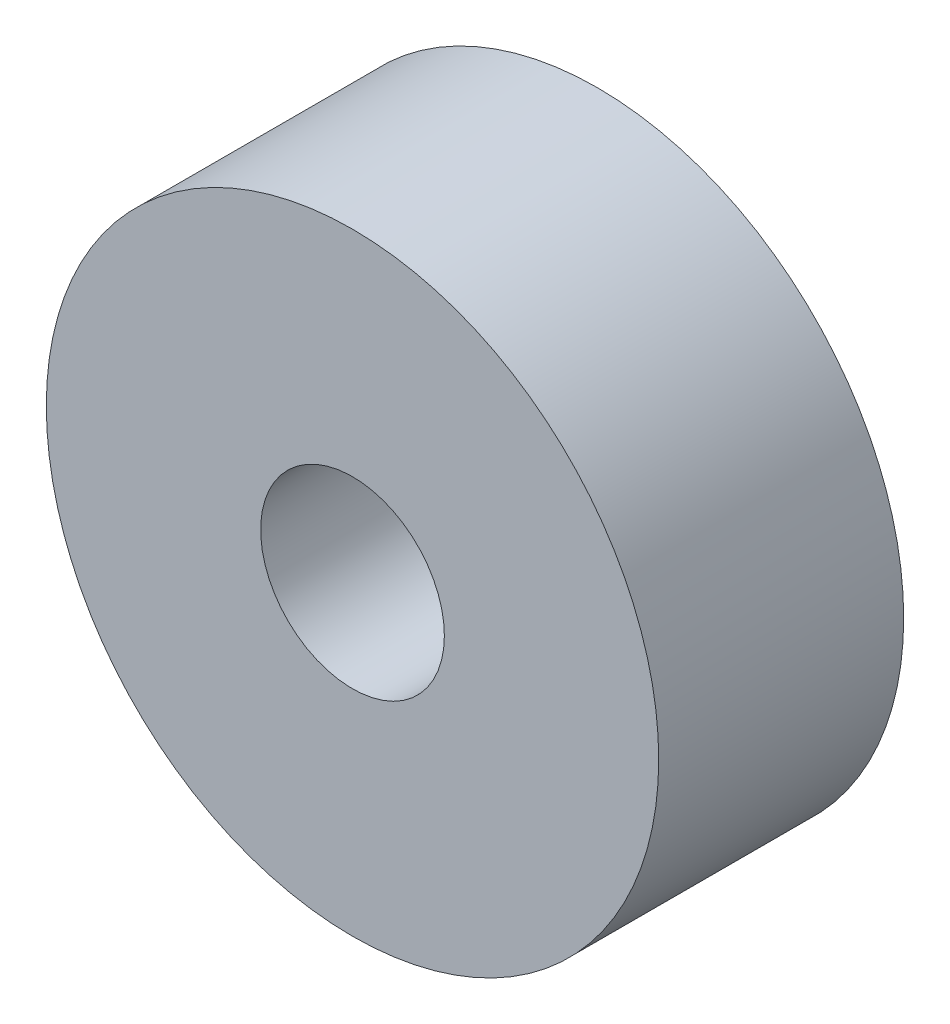
from build123d import *

# Parameters (mm, degrees)
SKETCH_1_R        = 5
SKETCH_1_R_2      = 1.5
EXTRUDE_312_DEPTH = 2


with BuildPart() as part:
    # Эскиз1 → Extrude 312 (new, symmetric)
    with BuildSketch(Plane.XY):
        Circle(SKETCH_1_R)
        Circle(SKETCH_1_R_2, mode=Mode.SUBTRACT)
    extrude(amount=EXTRUDE_312_DEPTH, both=True)


solid = part.part
